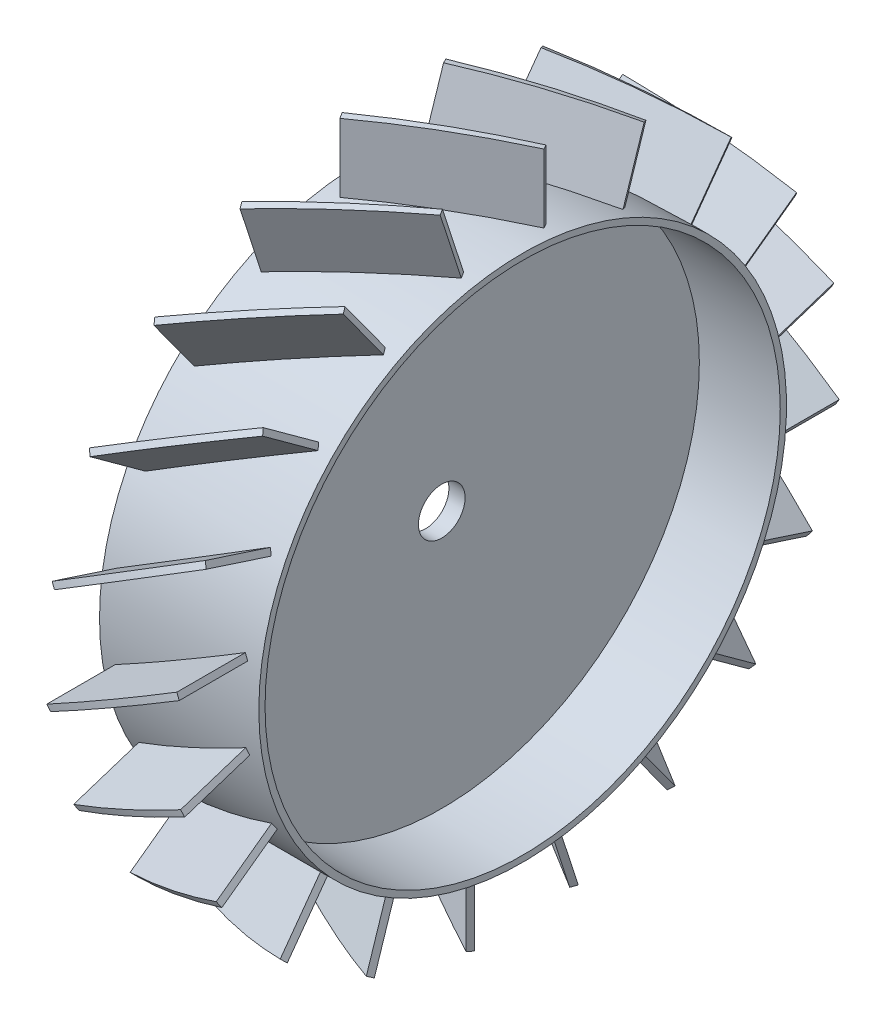
from build123d import *

# Parameters (mm, degrees)
BOSS_EXTRUDE1_REACH        = 165.116
BOSS_EXTRUDE1_START_RADIUS = 53.848
BOSS_EXTRUDE1_END_RADIUS   = 53.848
CIRPATTERN15_COUNT         = 20
SKETCH7_R                  = 4.7625
CUT_EXTRUDE1_DEPTH         = 98.934047154


with BuildPart() as part:
    # Sketch1 → Revolve1 (revolve)
    with BuildSketch(Plane(origin=(0, 0, 0), x_dir=(1, 0, 0), z_dir=(0, 1, 0))):
        Polygon((3.302, 0), (3.302, 52.578), (19.812, 52.578), (19.812, 53.848), (-12.7, 53.848), (-12.7, 52.578), (0, 52.578), (0, 0), align=None)
    revolve(axis=Axis((0, 0, 0), (1, 0, 0)))

    # Boss-Extrude1: from a cylinder face, 165.116 long prism both ways, kept between that surface and its translate by the depth
    boss_extrude1_start = Plane(origin=(3.556, 0, 0), z_dir=(-1, 0, 0)) * Cylinder(BOSS_EXTRUDE1_START_RADIUS, 438.928, mode=Mode.PRIVATE)
    boss_extrude1_end = Plane(origin=(3.556, 0, 13.97), z_dir=(-1, 0, 0)) * Cylinder(BOSS_EXTRUDE1_END_RADIUS, 438.928, mode=Mode.PRIVATE)
    # Sketch2 → Boss-Extrude1 (add, from a surface)
    with BuildSketch(Plane.XY.offset(83.82), mode=Mode.PRIVATE) as boss_extrude1_sk1:
        Polygon((-9.324727154, -8.169926131), (17.071727154, 7.070073869), (16.436727154, 8.169926131), (-9.959727154, -7.070073869), align=None)
    boss_extrude1_tool1 = extrude(boss_extrude1_sk1.sketch, amount=BOSS_EXTRUDE1_REACH, both=True, mode=Mode.PRIVATE)
    boss_extrude1 = ((boss_extrude1_tool1 - boss_extrude1_start) & boss_extrude1_end).solids().sort_by_distance((-12.7, 0, 53.848))[0]
    add(boss_extrude1)

    # CirPattern15: Boss-Extrude1 ×20 about axis
    cirpattern15_axis = Axis((19.812, 0, 0), (-1, 0, 0))
    for i in range(1, CIRPATTERN15_COUNT):
        add(boss_extrude1.rotate(cirpattern15_axis, i * 360 / CIRPATTERN15_COUNT))

    # Sketch7 → Cut-Extrude1 (cut, through all)
    with BuildSketch(Plane.ZY):
        Circle(SKETCH7_R)
    extrude(amount=-CUT_EXTRUDE1_DEPTH, mode=Mode.SUBTRACT)


solid = part.part
